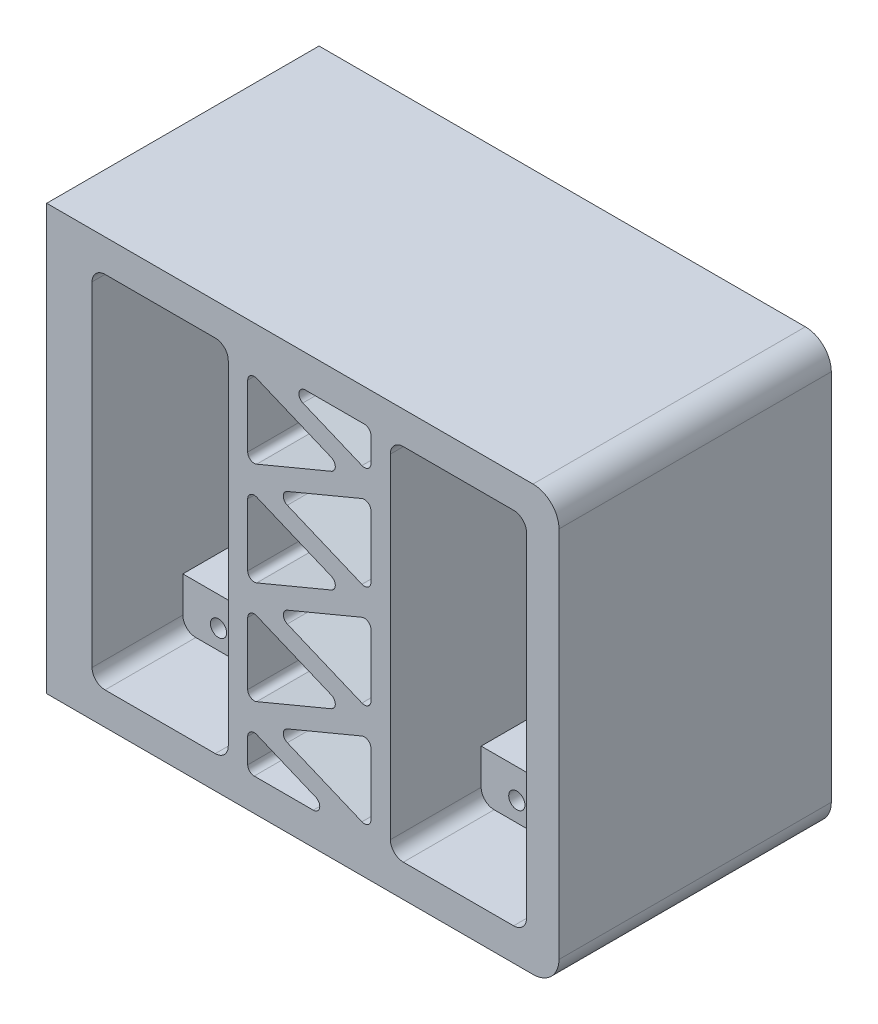
from build123d import *

# Parameters (mm, degrees)
SKETCH1_W           = 77
SKETCH1_H           = 65.5
SKETCH1_W_2         = 21
SKETCH1_H_2         = 40.5
BOSS_EXTRUDE2_DEPTH = 28
SKETCH1_4_W         = 77
SKETCH1_4_H         = 65.5
BOSS_EXTRUDE4_DEPTH = 14
SKETCH1_5_R         = 1.25
CUT_EXTRUDE1_DEPTH  = 12
CUT_EXTRUDE2_DEPTH  = 110.468031863
FILLET4_R           = 1
SKETCH8_W           = 21
SKETCH8_H           = 20
SKETCH8_W_2         = 16
CUT_EXTRUDE8_DEPTH  = 10
BOSS_EXTRUDE5_DEPTH = 1.5
BOSS_EXTRUDE6_DEPTH = 1.5
SKETCH13_W          = 42
SKETCH13_H          = 65.5
BOSS_EXTRUDE7_DEPTH = 2
FILLET3_R           = 2
SKETCH14_R          = 1.25
CUT_EXTRUDE9_DEPTH  = 7
FILLET7_R           = 4


with BuildPart() as part:
    # Sketch1 → Boss-Extrude2 (new body)
    with BuildSketch(Plane.XY):
        with Locations((38.5, 32.75)):
            Rectangle(SKETCH1_W, SKETCH1_H)
        with Locations((15.5, 32.75)):
            Rectangle(SKETCH1_W_2, SKETCH1_H_2, mode=Mode.SUBTRACT)
        with Locations((61.5, 32.75)):
            Rectangle(SKETCH1_W_2, SKETCH1_H_2, mode=Mode.SUBTRACT)
    extrude(amount=-BOSS_EXTRUDE2_DEPTH)

    # Sketch1<4> → Boss-Extrude4 (add)
    with BuildSketch(Plane.XY):
        with Locations((38.5, 32.75)):
            Rectangle(SKETCH1_4_W, SKETCH1_4_H)
        Polygon((5, 53), (5, 60.5), (26, 60.5), (26, 53), (26, 12.5), (26, 5), (5, 5), (5, 12.5), align=None, mode=Mode.SUBTRACT)
        Polygon((51, 53), (51, 60.5), (72, 60.5), (72, 53), (72, 12.5), (72, 5), (51, 5), (51, 12.5), align=None, mode=Mode.SUBTRACT)
    extrude(amount=BOSS_EXTRUDE4_DEPTH)

    # Sketch1<5> → Cut-Extrude1 (cut)
    with BuildSketch(Plane.XY):
        with Locations((10.5, 57.5)):
            Circle(SKETCH1_5_R)
        with Locations((20.5, 57.5)):
            Circle(SKETCH1_5_R)
        with Locations((10.5, 8)):
            Circle(SKETCH1_5_R)
        with Locations((20.5, 8)):
            Circle(SKETCH1_5_R)
        with Locations((56.5, 57.5)):
            Circle(SKETCH1_5_R)
        with Locations((66.5, 57.5)):
            Circle(SKETCH1_5_R)
        with Locations((66.5, 8)):
            Circle(SKETCH1_5_R)
        with Locations((56.5, 8)):
            Circle(SKETCH1_5_R)
    extrude(amount=-CUT_EXTRUDE1_DEPTH, mode=Mode.SUBTRACT)

    # Sketch5 → Cut-Extrude2 (cut, through all)
    with BuildSketch(Plane.XY.offset(14)):
        Polygon((44.10498905, 52.571428571), (29, 58.874638288), (29, 46.268218855), align=None)
        Polygon((48, 60.5), (32.89501095, 60.5), (48, 54.196790284), align=None)
        Polygon((44.10498905, 36.714285714), (29, 43.017495431), (29, 30.411075998), align=None)
        Polygon((48, 38.339647426), (48, 50.946066859), (32.89501095, 44.642857143), align=None)
        Polygon((48, 22.482504569), (48, 35.088924002), (32.89501095, 28.785714286), align=None)
        Polygon((44.10498905, 20.857142857), (29, 27.160352574), (29, 14.553933141), align=None)
        Polygon((48, 6.625361712), (48, 19.231781145), (32.89501095, 12.928571429), align=None)
        Polygon((44.10498905, 5), (29, 11.303209716), (29, 5), align=None)
    extrude(amount=-CUT_EXTRUDE2_DEPTH, mode=Mode.SUBTRACT)

    # Fillet4
    fillet4_edges = [part.edges().sort_by_distance(p)[0] for p in [
        (44.10498905, 5, -7),
        (29, 11.303209716, -7),
        (29, 5, -7),
        (48, 6.625361712, -7),
        (48, 19.231781145, -7),
        (32.89501095, 12.928571429, -7),
        (29, 14.553933141, -7),
        (29, 27.160352574, -7),
        (44.10498905, 20.857142857, -7),
        (48, 22.482504569, -7),
        (48, 35.088924002, -7),
        (32.89501095, 28.785714286, -7),
        (44.10498905, 36.714285714, -7),
        (29, 30.411075998, -7),
        (29, 43.017495431, -7),
        (48, 38.339647426, -7),
        (32.89501095, 44.642857143, -7),
        (48, 50.946066859, -7),
        (29, 46.268218855, -7),
        (44.10498905, 52.571428571, -7),
        (29, 58.874638288, -7),
        (48, 54.196790284, -7),
        (48, 60.5, -7),
        (32.89501095, 60.5, -7),
    ]]
    fillet(fillet4_edges, radius=FILLET4_R)

    # Sketch8 → Cut-Extrude8 (cut)
    with BuildSketch(Plane(origin=(0, 12.5, 0), x_dir=(1, 0, 0), z_dir=(0, 1, 0))):
        with Locations((15.5, 18)):
            Rectangle(SKETCH8_W, SKETCH8_H)
        with Locations((59, 18)):
            Rectangle(SKETCH8_W_2, SKETCH8_H)
    cut_extrude8 = extrude(amount=-CUT_EXTRUDE8_DEPTH, mode=Mode.SUBTRACT)

    # Sketch10 → Boss-Extrude5 (add, symmetric)
    with BuildSketch(Plane(origin=(61.5, 0, 0), x_dir=(0, 0, -1), z_dir=(1, 0, 0))):
        Polygon((8, 2.5), (18, 2.5), (8, 12.5), align=None)
    boss_extrude5 = extrude(amount=BOSS_EXTRUDE5_DEPTH, both=True)

    # Sketch11 → Boss-Extrude6 (add, symmetric)
    with BuildSketch(Plane(origin=(15.5, 0, 0), x_dir=(0, 0, -1), z_dir=(1, 0, 0))):
        Polygon((8, 2.5), (18, 2.5), (8, 12.5), align=None)
    boss_extrude6 = extrude(amount=BOSS_EXTRUDE6_DEPTH, both=True)

    # Mirror2: Cut-Extrude8, Boss-Extrude5, Boss-Extrude6 across plane
    add(cut_extrude8.mirror(Plane.ZX.offset(32.75)), mode=Mode.SUBTRACT)
    add(boss_extrude5.mirror(Plane.ZX.offset(32.75)))
    add(boss_extrude6.mirror(Plane.ZX.offset(32.75)))

    # Sketch13 → Boss-Extrude7 (add)
    with BuildSketch(Plane.ZY):
        with Locations((-7, 32.75)):
            Rectangle(SKETCH13_W, SKETCH13_H)
    extrude(amount=BOSS_EXTRUDE7_DEPTH)

    # Fillet3
    fillet3_edges = [part.edges().sort_by_distance(p)[0] for p in [
        (51, 60.5, 7),
        (72, 5, 7),
        (72, 60.5, 7),
        (51, 5, 7),
        (5, 5, 7),
        (26, 5, 7),
        (26, 60.5, 7),
        (5, 60.5, 7),
        (67, 63, -18),
        (67, 2.5, -18),
        (51, 2.5, -18),
        (51, 63, -18),
        (26, 63, -18),
        (26, 2.5, -18),
        (5, 63, -18),
        (5, 2.5, -18),
    ]]
    fillet(fillet3_edges, radius=FILLET3_R)

    # Sketch14 → Cut-Extrude9 (cut)
    with BuildSketch(Plane.ZY.offset(2)):
        with Locations((-24, 61.5)):
            Circle(SKETCH14_R)
        with Locations((10, 61.5)):
            Circle(SKETCH14_R)
        with Locations((10, 4)):
            Circle(SKETCH14_R)
        with Locations((-24, 4)):
            Circle(SKETCH14_R)
    extrude(amount=-CUT_EXTRUDE9_DEPTH, mode=Mode.SUBTRACT)

    # Fillet7
    fillet7_edges = [part.edges().sort_by_distance(p)[0] for p in [
        (77, 65.5, -7),
        (77, 0, -7),
    ]]
    fillet(fillet7_edges, radius=FILLET7_R)


solid = part.part
